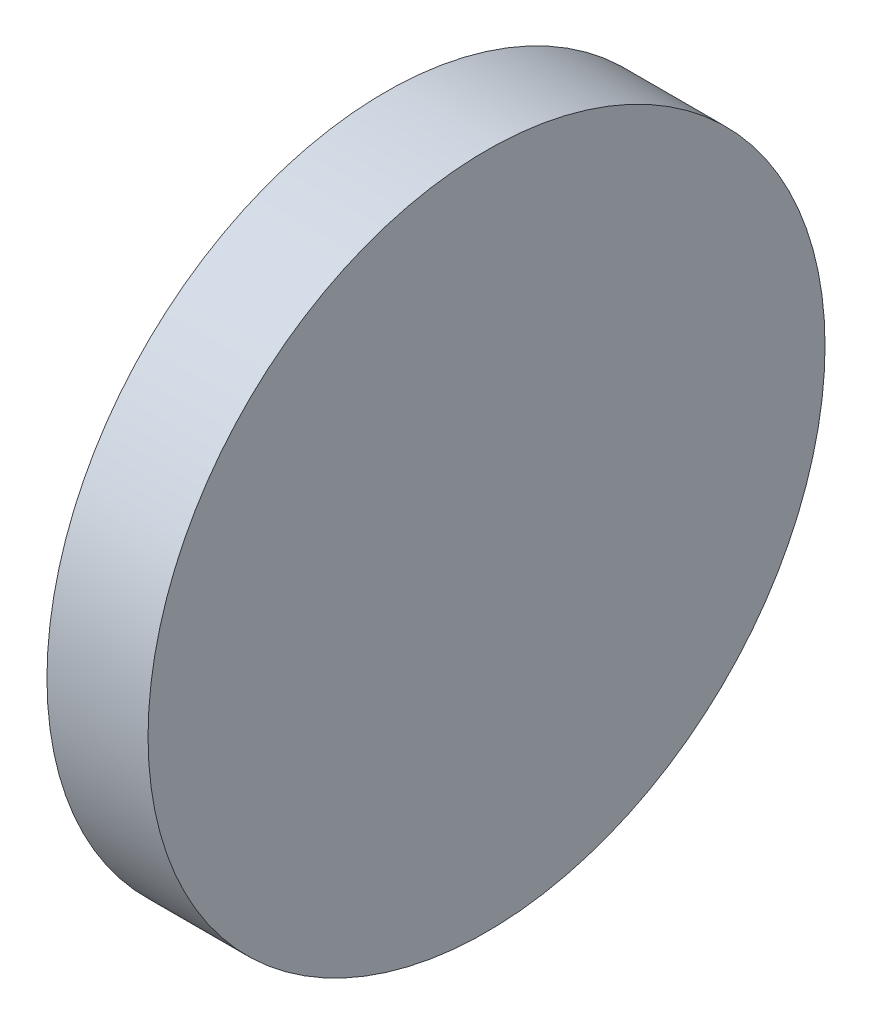
from build123d import *

# Parameters (mm, degrees)
SKETCH1_W = 7
SKETCH1_H = 23.4442


with BuildPart() as part:
    # Sketch1 → Revolve1 (revolve)
    with BuildSketch(Plane.XY):
        Rectangle(SKETCH1_W, SKETCH1_H)
    revolve(axis=Axis((-3.5, -11.7221, 0), (1, 0, 0)))


solid = part.part
